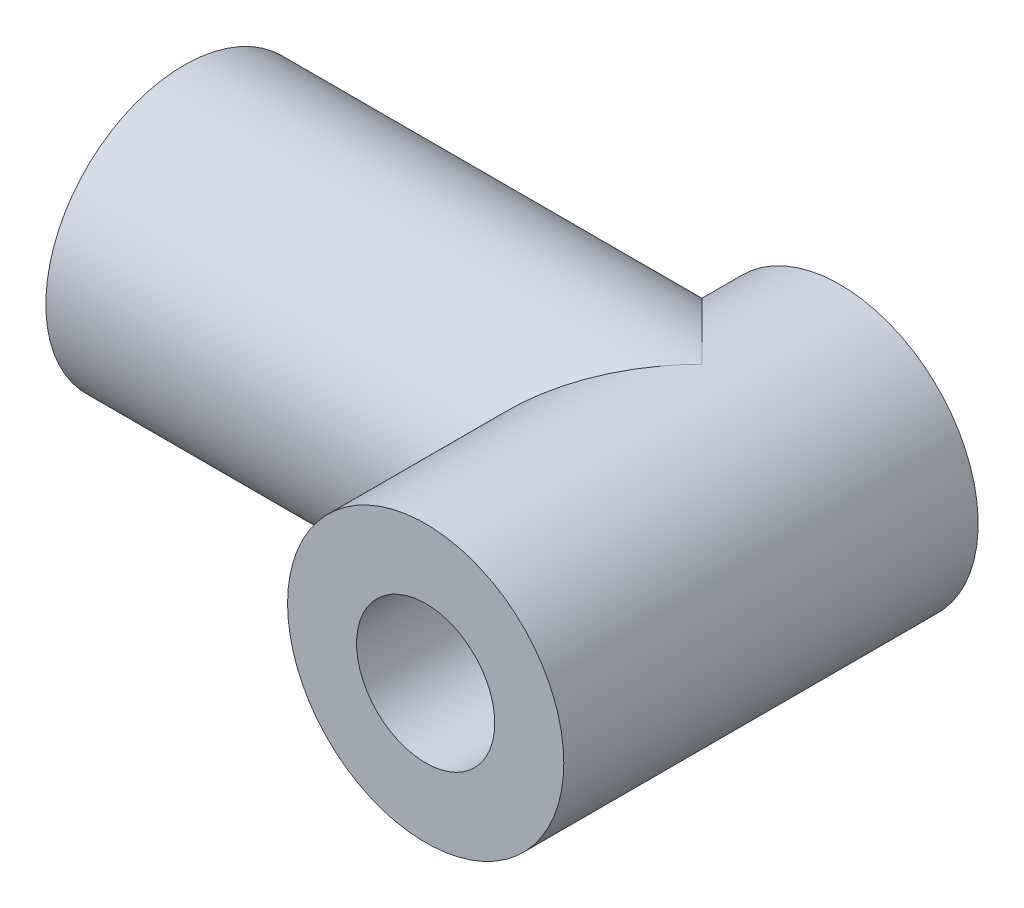
from build123d import *

# Parameters (mm, degrees)
SKETCH1_R           = 4
SKETCH1_R_2         = 2
BOSS_EXTRUDE1_DEPTH = 12
SKETCH2_R           = 4
SKETCH2_R_2         = 2
BOSS_EXTRUDE2_DEPTH = 15
SKETCH3_R           = 2
CUT_EXTRUDE1_DEPTH  = 20.621417008
CUT_EXTRUDE2_REACH  = 24.825
SKETCH4_R           = 2


with BuildPart() as part:
    # Sketch1 → Boss-Extrude1 (new body)
    with BuildSketch(Plane.XY):
        Circle(SKETCH1_R)
        Circle(SKETCH1_R_2, mode=Mode.SUBTRACT)
    extrude(amount=BOSS_EXTRUDE1_DEPTH)

    # Sketch2 → Boss-Extrude2 (add)
    with BuildSketch(Plane(origin=(0, 0, 0), x_dir=(0, 0, -1), z_dir=(1, 0, 0))):
        with Locations((-4, 0)):
            Circle(SKETCH2_R)
        with Locations((-4, 0)):
            Circle(SKETCH2_R_2, mode=Mode.SUBTRACT)
    extrude(amount=-BOSS_EXTRUDE2_DEPTH)

    # Sketch3 → Cut-Extrude1 (cut, through all)
    with BuildSketch(Plane(origin=(0, 0, 0), x_dir=(-1, 0, 0), z_dir=(0, 0, -1))):
        Circle(SKETCH3_R)
    extrude(amount=-CUT_EXTRUDE1_DEPTH, mode=Mode.SUBTRACT)

    # Sketch4 → Cut-Extrude2 (cut, up to next)
    with BuildSketch(Plane.ZY.offset(15), mode=Mode.PRIVATE) as cut_extrude2_sk1:
        with Locations((4, 0)):
            Circle(SKETCH4_R)
    cut_extrude2_tool1 = extrude(cut_extrude2_sk1.sketch, amount=-CUT_EXTRUDE2_REACH, mode=Mode.PRIVATE) & part.part
    add(cut_extrude2_tool1.solids().sort_by_distance((-15, 0, 4))[0], mode=Mode.SUBTRACT)


solid = part.part
